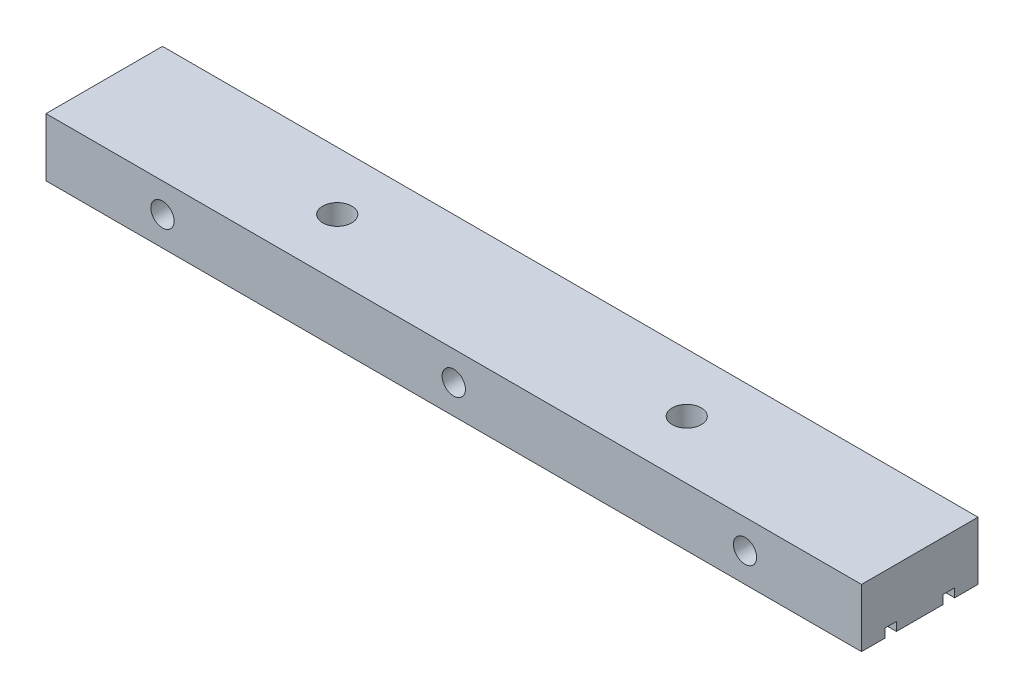
from build123d import *

# Parameters (mm, degrees)
IZIM1_W                                      = 140
IZIM1_H                                      = 10
Y_KSEKLIK_EKSTR_ZYON1_DEPTH                  = 20
F_4_0MM_SAPLAMA_DELIKLERI1_D                 = 5
F_4_0MM_SAPLAMA_DELIKLERI1_DEPTH             = 8
IZIM6_W                                      = 2
IZIM6_H                                      = 1.5
KES_EKSTR_ZYON1_DEPTH                        = 142.774468788
M5_ALT_GEN_BA_L_C_VATA_IN_HAV_A1_D           = 4
M5_ALT_GEN_BA_L_C_VATA_IN_HAV_A1_CBORE_D     = 6.5
M5_ALT_GEN_BA_L_C_VATA_IN_HAV_A1_CBORE_DEPTH = 6


with BuildPart() as part:
    # Çizim1 → Yükseklik-Ekstrüzyon1 (new body)
    with BuildSketch(Plane.XY):
        with Locations((70, 5)):
            Rectangle(IZIM1_W, IZIM1_H)
    extrude(amount=Y_KSEKLIK_EKSTR_ZYON1_DEPTH)

    # Ø4.0mm Saplama Delikleri1
    with Locations(Plane(origin=(40, 10, 10), x_dir=(0, 0, 1), z_dir=(0, 1, 0))):
        with Locations((0, 0), (0, 60)):
            Hole(F_4_0MM_SAPLAMA_DELIKLERI1_D / 2, depth=F_4_0MM_SAPLAMA_DELIKLERI1_DEPTH)

    # Çizim6 → Kes-Ekstrüzyon1 (cut, through all)
    with BuildSketch(Plane.ZY):
        with Locations((5, 0.75)):
            Rectangle(IZIM6_W, IZIM6_H)
        with Locations((15, 0.75)):
            Rectangle(IZIM6_W, IZIM6_H)
    extrude(amount=-KES_EKSTR_ZYON1_DEPTH, mode=Mode.SUBTRACT)

    # M5 Altıgen Başlı Cıvata İçin Havşa1 (through all)
    with Locations(Plane(origin=(120, 5, 0), x_dir=(-1, 0, 0), z_dir=(0, 0, -1))):
        with Locations((0, 0), (50, 0), (100, 0)):
            CounterBoreHole(M5_ALT_GEN_BA_L_C_VATA_IN_HAV_A1_D / 2, M5_ALT_GEN_BA_L_C_VATA_IN_HAV_A1_CBORE_D / 2, M5_ALT_GEN_BA_L_C_VATA_IN_HAV_A1_CBORE_DEPTH)


solid = part.part
